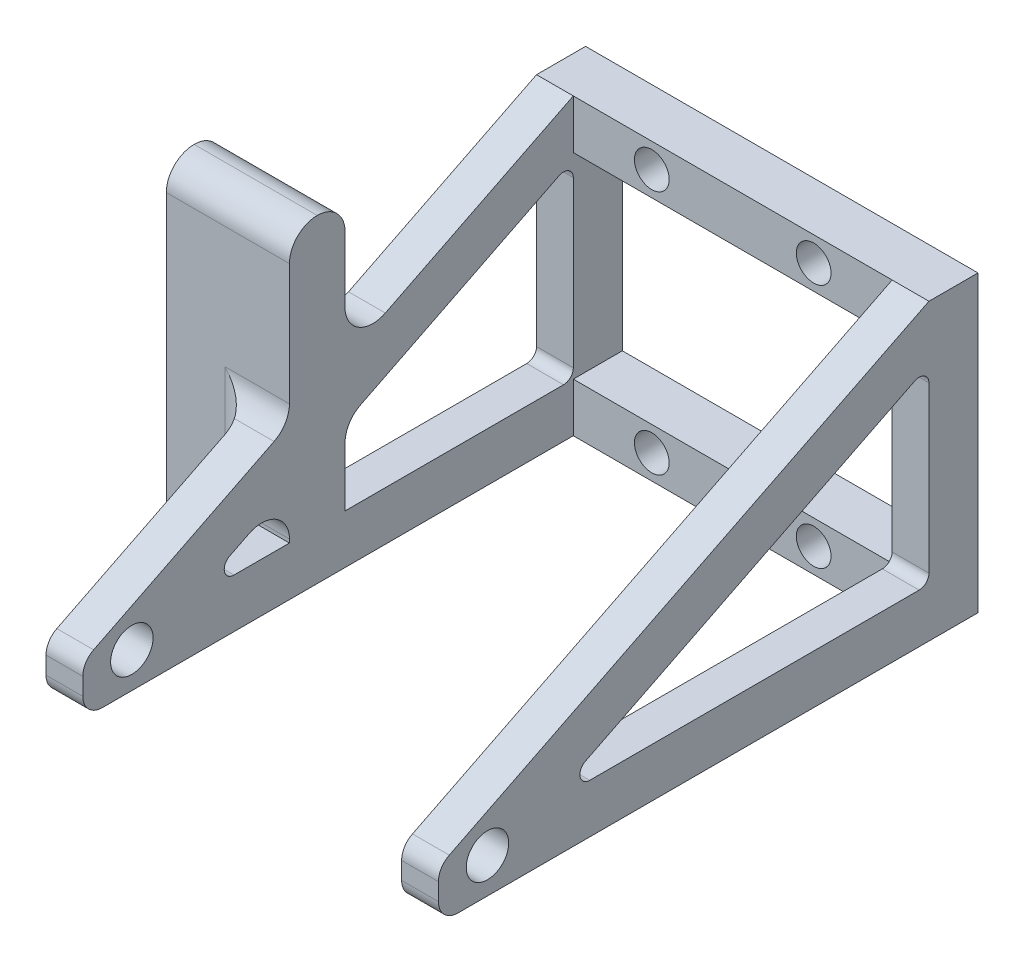
from build123d import *

# Parameters (mm, degrees)
BOSS_EXTRUDE1_DEPTH   = 50.8
SKETCH2_W             = 41.275
SKETCH2_H             = 25.4
CUT_EXTRUDE1_DEPTH    = 95.399536545
SKETCH3_W             = 41.275
SKETCH3_H             = 63.5
CUT_EXTRUDE2_DEPTH    = 95.399536545
SKETCH4_R             = 2.75
CUT_EXTRUDE3_DEPTH    = 95.399536545
FILLET1_R             = 2.54
FILLET3_DEPTH         = 4.7625
FILLET3_START         = 46.0375
FILLET3_2_DEPTH       = 4.7625
F_8_CLEARANCE_HOLE1_D = 4.4958
BOSS_EXTRUDE2_START   = -4.7625
SKETCH9_W             = 7.2
SKETCH9_H             = 41.275
BOSS_EXTRUDE2_DEPTH   = 15.9375
SKETCH10_R            = 3.1
CUT_EXTRUDE4_DEPTH    = 0.8
SKETCH10_3_R          = 2.4
CUT_EXTRUDE5_DEPTH    = 7.2
CUT_EXTRUDE9_START    = -7.2
SKETCH10_4_R          = 3.1
SKETCH10_4_R_2        = 2.4
CUT_EXTRUDE9_DEPTH    = 1
FILLET4_R             = 3.6


with BuildPart() as part:
    # Sketch1 → Boss-Extrude1 (new body)
    with BuildSketch(Plane(origin=(0, 0, 0), x_dir=(0, 0, -1), z_dir=(1, 0, 0))):
        Polygon((0, 0), (0, 38.1), (-6.35, 38.1), (-69.85, 6.35), (-69.85, 0), align=None)
        Polygon((-55.650968343, 6.35), (-6.35, 6.35), (-6.35, 31.000484171), align=None, mode=Mode.SUBTRACT)
    extrude(amount=BOSS_EXTRUDE1_DEPTH)

    # Sketch2 → Cut-Extrude1 (cut, through all)
    with BuildSketch(Plane.XY.offset(69.85)):
        with Locations((25.4, 19.05)):
            Rectangle(SKETCH2_W, SKETCH2_H)
    extrude(amount=-CUT_EXTRUDE1_DEPTH, mode=Mode.SUBTRACT)

    # Sketch3 → Cut-Extrude2 (cut, through all)
    with BuildSketch(Plane.XZ):
        with Locations((25.4, 38.1)):
            Rectangle(SKETCH3_W, SKETCH3_H)
    extrude(amount=-CUT_EXTRUDE2_DEPTH, mode=Mode.SUBTRACT)

    # Sketch4 → Cut-Extrude3 (cut, through all)
    with BuildSketch(Plane(origin=(50.8, 0, 0), x_dir=(0, 0, -1), z_dir=(1, 0, 0))):
        with Locations((-63.5, 4.572)):
            Circle(SKETCH4_R)
    extrude(amount=-CUT_EXTRUDE3_DEPTH, mode=Mode.SUBTRACT)

    # Fillet1
    fillet1_edges = [part.edges().sort_by_distance(p)[0] for p in [
        (2.38125, 6.35, 69.85),
        (2.38125, 0, 69.85),
        (48.41875, 0, 69.85),
        (48.41875, 6.35, 69.85),
    ]]
    fillet(fillet1_edges, radius=FILLET1_R)

    # Fillet3: read off the stored shape, not the designer's step
    # Fillet3 outline → Fillet3 (add)
    with BuildSketch(Plane.YZ):
        with BuildLine():
            ThreePointArc((7.62, 6.35), (6.721974388, 6.721974388), (6.35, 7.62))
            Line((6.35, 7.62), (6.35, 6.35))
            Line((6.35, 6.35), (7.62, 6.35))
        make_face()
        with BuildLine():
            Line((6.35, 55.650968343), (6.35, 50.271162011))
            ThreePointArc((6.35, 50.271162011), (7.328213791, 51.507188228), (8.755922533, 50.839123278))
            Line((8.755922533, 50.839123278), (6.35, 55.650968343))
        make_face()
        with BuildLine():
            ThreePointArc((30.081503538, 8.187961266), (30.025907532, 6.952321488), (28.945581006, 6.35))
            Line((28.945581006, 6.35), (31.000484171, 6.35))
            Line((31.000484171, 6.35), (30.081503538, 8.187961266))
        make_face()
    extrude(amount=FILLET3_DEPTH)

    # Fillet3 2 outline → Fillet3 2 (add)
    with BuildSketch(Plane.YZ.offset(FILLET3_START)):
        with BuildLine():
            ThreePointArc((7.62, 6.35), (6.721974388, 6.721974388), (6.35, 7.62))
            Line((6.35, 7.62), (6.35, 6.35))
            Line((6.35, 6.35), (7.62, 6.35))
        make_face()
        with BuildLine():
            Line((6.35, 55.650968343), (6.35, 50.271162011))
            ThreePointArc((6.35, 50.271162011), (7.328213791, 51.507188228), (8.755922533, 50.839123278))
            Line((8.755922533, 50.839123278), (6.35, 55.650968343))
        make_face()
        with BuildLine():
            ThreePointArc((30.081503538, 8.187961266), (30.025907532, 6.952321488), (28.945581006, 6.35))
            Line((28.945581006, 6.35), (31.000484171, 6.35))
            Line((31.000484171, 6.35), (30.081503538, 8.187961266))
        make_face()
    extrude(amount=FILLET3_2_DEPTH)

    # #8 Clearance Hole1 (through all)
    with Locations(Plane.XY.offset(6.35)):
        with Locations((14.9225, 34.925), (35.8775, 34.925), (14.9225, 3.175), (35.8775, 3.175)):
            Hole(F_8_CLEARANCE_HOLE1_D / 2)

    # Sketch9 → Boss-Extrude2 (add)
    with BuildSketch(Plane.ZY.offset(BOSS_EXTRUDE2_START)):
        with Locations((39.5, 20.6375)):
            Rectangle(SKETCH9_W, SKETCH9_H)
    extrude(amount=BOSS_EXTRUDE2_DEPTH)

    # Sketch10 → Cut-Extrude4 (cut)
    with BuildSketch(Plane.ZY.offset(11.175)):
        with Locations((39.5, 36.572)):
            Circle(SKETCH10_R)
        with Locations((39.5, 28.572)):
            Circle(SKETCH10_R)
        with Locations((39.5, 20.572)):
            Circle(SKETCH10_R)
    extrude(amount=-CUT_EXTRUDE4_DEPTH, mode=Mode.SUBTRACT)

    # Sketch10<3> → Cut-Extrude5 (cut)
    with BuildSketch(Plane.ZY.offset(11.175)):
        with Locations((39.5, 20.572)):
            Circle(SKETCH10_3_R)
        with Locations((39.5, 36.572)):
            Circle(SKETCH10_3_R)
        with Locations((39.5, 28.572)):
            Circle(SKETCH10_3_R)
    extrude(amount=-CUT_EXTRUDE5_DEPTH, mode=Mode.SUBTRACT)

    # Sketch10<4> → Cut-Extrude9 (cut)
    # profile 1 of 5: a face of its own
    with BuildSketch(Plane.ZY.offset(11.175).offset(CUT_EXTRUDE9_START)):
        with Locations((39.5, 28.572)):
            Circle(SKETCH10_4_R)
        with Locations((39.5, 28.572)):
            Circle(SKETCH10_4_R_2, mode=Mode.SUBTRACT)
    # profile 2 of 5: a face of its own
    with BuildSketch(Plane.ZY.offset(11.175).offset(CUT_EXTRUDE9_START)):
        with Locations((39.5, 28.572)):
            Circle(SKETCH10_4_R_2)
    # profile 3 of 5: a face of its own
    with BuildSketch(Plane.ZY.offset(11.175).offset(CUT_EXTRUDE9_START)):
        with Locations((39.5, 20.572)):
            Circle(SKETCH10_4_R)
        with Locations((39.5, 20.572)):
            Circle(SKETCH10_4_R_2, mode=Mode.SUBTRACT)
    # profile 4 of 5: a face of its own
    with BuildSketch(Plane.ZY.offset(11.175).offset(CUT_EXTRUDE9_START)):
        with Locations((39.5, 20.572)):
            Circle(SKETCH10_4_R_2)
    # profile 5 of 5: a face of its own
    with BuildSketch(Plane.ZY.offset(11.175).offset(CUT_EXTRUDE9_START)):
        with Locations((39.5, 36.572)):
            Circle(SKETCH10_4_R)
    extrude(amount=-CUT_EXTRUDE9_DEPTH, mode=Mode.SUBTRACT)

    # Fillet4
    fillet4_edges = [part.edges().sort_by_distance(p)[0] for p in [
        (-3.20625, 41.275, 43.1),
        (-3.20625, 41.275, 35.9),
        (2.38125, 12.625484171, 43.1),
        (0, 16.175242086, 43.1),
        (2.38125, 19.725, 43.1),
        (2.38125, 16.225484171, 35.9),
        (0, 19.775242086, 35.9),
        (2.38125, 23.325, 35.9),
    ]]
    fillet(fillet4_edges, radius=FILLET4_R - 0.0001)  # a hair under: the kernel refuses the full size


solid = part.part
